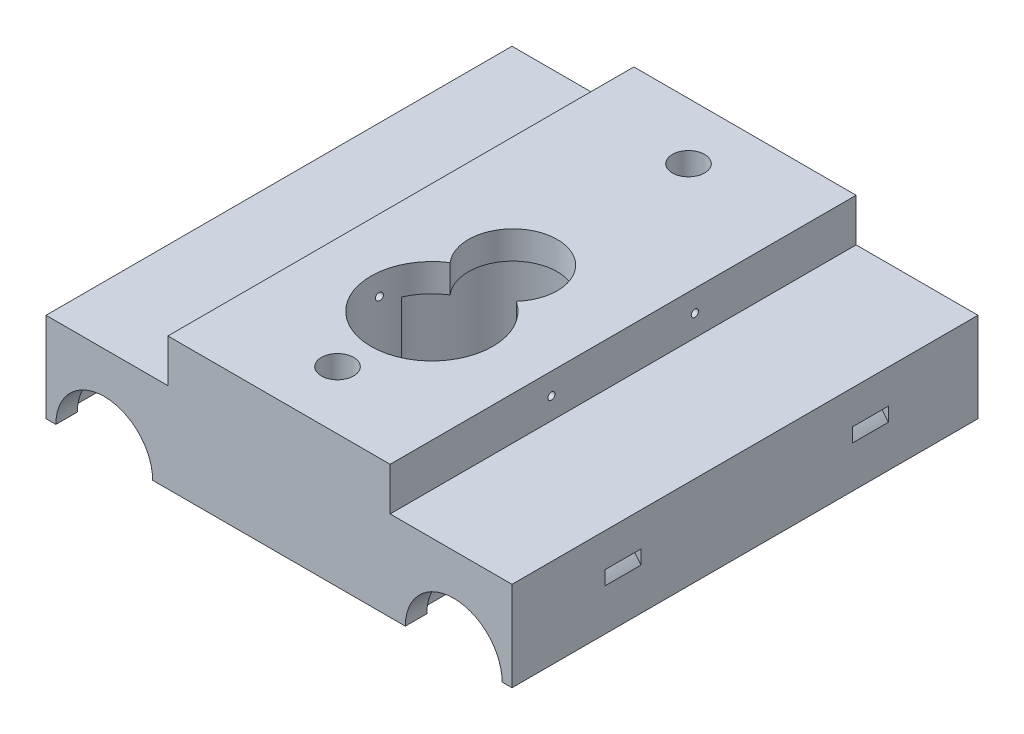
from build123d import *
from build123d.topology import SkipClean

# Parameters (mm, degrees)
SKETCH_1_W           = 65
SKETCH_1_H           = 65
EXTRUDE_1_DEPTH      = 17
CUT_EXTRUDE_1_DEPTH  = 59
CUT_EXTRUDE_2_DEPTH  = 79.260612028
EXTRUDE_2_DEPTH      = 10
SKETCH_12_W          = 35.24
SKETCH_12_H          = 8.5
CUT_EXTRUDE_5_DEPTH  = 79.260612028
SKETCH_17_R          = 2.25
CUT_EXTRUDE_8_DEPTH  = 58.965697588
EXTRUDE_START        = 10
SKETCH_18_W          = 65
SKETCH_18_H          = 65
SKETCH_18_R          = 2.25
EXTRUDE_3_DEPTH      = 10
CUT_EXTRUDE_START    = -10
SKETCH_9_R           = 11.25
SKETCH_9_R_2         = 10
CUT_EXTRUDE_3_DEPTH  = 5
CUT_EXTRUDE_START_2  = -20
SKETCH_10_R          = 11.25
SKETCH_10_R_2        = 10
CUT_EXTRUDE_4_DEPTH  = 5
SKETCH_19_W          = 65
SKETCH_19_H          = 6
CUT_EXTRUDE_9_DEPTH  = 17
SKETCH_20_W          = 65
SKETCH_20_H          = 6
CUT_EXTRUDE_10_DEPTH = 17
SKETCH_21_R          = 0.5
CUT_EXTRUDE_11_DEPTH = 69.629794564
CUT_EXTRUDE_12_DEPTH = 3.9
CUT_EXTRUDE_13_DEPTH = 60.168674963


with BuildPart() as part:
    # Эскиз1 → Бобышка-Вытянуть1 (new body)
    with BuildSketch(Plane(origin=(0, 0, 0), x_dir=(1, 0, 0), z_dir=(0, 1, 0))):
        with Locations((7.633818594, -8.451785088)):
            Rectangle(SKETCH_1_W, SKETCH_1_H)
    extrude(amount=EXTRUDE_1_DEPTH)

    # Эскиз3 → Вырез-Вытянуть1 (cut)
    with BuildSketch(Plane.XY.offset(37.951785088)):
        with BuildLine():
            Line((39.753818594, 8.5), (40.133818594, 8.5))
            Line((40.133818594, 8.5), (40.133818594, 0))
            Line((40.133818594, 0), (24.253818594, 0))
            Line((24.253818594, 0), (24.253818594, 8.5))
            ThreePointArc((24.253818594, 8.5), (32.003818594, 16.25), (39.753818594, 8.5))
        make_face()
        with BuildLine():
            Line((-24.486181406, 8.5), (-24.866181406, 8.5))
            Line((-24.866181406, 8.5), (-24.866181406, 0))
            Line((-24.866181406, 0), (-8.986181406, 0))
            Line((-8.986181406, 0), (-8.986181406, 8.5))
            ThreePointArc((-8.986181406, 8.5), (-16.736181406, 16.25), (-24.486181406, 8.5))
        make_face()
    extrude(amount=-CUT_EXTRUDE_1_DEPTH, mode=Mode.SUBTRACT)

    # Эскиз5 → Вырез-Вытянуть2 (cut, through all)
    with BuildSketch(Plane.XY.offset(40.951785088)):
        with BuildLine():
            Line((-23.486181406, 8.5), (-24.866181406, 8.5))
            Line((-24.866181406, 8.5), (-24.866181406, 0))
            Line((-24.866181406, 0), (-9.986181406, 0))
            Line((-9.986181406, 0), (-9.986181406, 8.5))
            ThreePointArc((-9.986181406, 8.5), (-16.736181406, 15.25), (-23.486181406, 8.5))
        make_face()
        with BuildLine():
            Line((38.753818594, 8.5), (40.133818594, 8.5))
            Line((40.133818594, 8.5), (40.133818594, 0))
            Line((40.133818594, 0), (25.253818594, 0))
            Line((25.253818594, 0), (25.253818594, 8.5))
            ThreePointArc((25.253818594, 8.5), (32.003818594, 15.25), (38.753818594, 8.5))
        make_face()
    extrude(amount=-CUT_EXTRUDE_2_DEPTH, mode=Mode.SUBTRACT)

    # Эскиз6 → Бобышка-Вытянуть2 (add)
    with BuildSketch(Plane.XY.offset(13.451785088)):
        with BuildLine():
            Line((-23.486181406, 8.5), (-24.866181406, 8.5))
            Line((-24.866181406, 8.5), (-24.866181406, 17))
            Line((-24.866181406, 17), (-9.986181406, 17))
            Line((-9.986181406, 17), (40.133818594, 17))
            Line((40.133818594, 17), (40.133818594, 8.5))
            Line((40.133818594, 8.5), (38.753818594, 8.5))
            ThreePointArc((38.753818594, 8.5), (32.003818594, 15.25), (25.253818594, 8.5))
            Line((25.253818594, 8.5), (25.253818594, 0))
            Line((25.253818594, 0), (-9.986181406, 0))
            Line((-9.986181406, 0), (-9.986181406, 8.5))
            ThreePointArc((-9.986181406, 8.5), (-16.736181406, 15.25), (-23.486181406, 8.5))
        make_face()
    extrude(amount=-EXTRUDE_2_DEPTH)

    # Эскиз12 → Вырез-Вытянуть5 (cut, through all)
    with BuildSketch(Plane.XY.offset(40.951785088)):
        with Locations((7.633818594, 4.25)):
            Rectangle(SKETCH_12_W, SKETCH_12_H)
    extrude(amount=-CUT_EXTRUDE_5_DEPTH, mode=Mode.SUBTRACT)

    # Эскиз17 → Вырез-Вытянуть8 (cut, through all)
    with BuildSketch(Plane(origin=(0, 17, 0), x_dir=(1, 0, 0), z_dir=(0, 1, 0))):
        with Locations((7.633818594, 16.168732948)):
            Circle(SKETCH_17_R)
        with Locations((7.676184998, -32.831267052)):
            Circle(SKETCH_17_R)
    extrude(amount=-CUT_EXTRUDE_8_DEPTH, mode=Mode.SUBTRACT)

    # Эскиз18 → Бобышка-Вытянуть3 (add)
    with BuildSketch(Plane(origin=(0, 17, 0), x_dir=(1, 0, 0), z_dir=(0, 1, 0)).offset(EXTRUDE_START)):
        with Locations((7.633818594, -8.451785088)):
            Rectangle(SKETCH_18_W, SKETCH_18_H)
        with Locations((7.633818594, 16.168732948)):
            Circle(SKETCH_18_R, mode=Mode.SUBTRACT)
        with Locations((7.676184998, -32.831267052)):
            Circle(SKETCH_18_R, mode=Mode.SUBTRACT)
    extrude(amount=-EXTRUDE_3_DEPTH)

    # Эскиз9 → Вырез-Вытянуть3 (cut)
    # profile 1 of 2: a face of its own
    with BuildSketch(Plane.XY.offset(37.951785088).offset(CUT_EXTRUDE_START)):
        with Locations((-16.736181406, 8.5)):
            Circle(SKETCH_9_R)
        with Locations((-16.736181406, 8.5)):
            Circle(SKETCH_9_R_2, mode=Mode.SUBTRACT)
    # profile 2 of 2: a face of its own
    with BuildSketch(Plane.XY.offset(37.951785088).offset(CUT_EXTRUDE_START)):
        with Locations((32.003818594, 8.5)):
            Circle(SKETCH_9_R)
        with Locations((32.003818594, 8.5)):
            Circle(SKETCH_9_R_2, mode=Mode.SUBTRACT)
    extrude(amount=-CUT_EXTRUDE_3_DEPTH, mode=Mode.SUBTRACT)

    # Эскиз10 → Вырез-Вытянуть4 (cut)
    # profile 1 of 2: a face of its own
    with BuildSketch(Plane.XY.offset(13.451785088).offset(CUT_EXTRUDE_START_2)):
        with Locations((-16.736181406, 8.5)):
            Circle(SKETCH_10_R)
        with Locations((-16.736181406, 8.5)):
            Circle(SKETCH_10_R_2, mode=Mode.SUBTRACT)
    # profile 2 of 2: a face of its own
    with BuildSketch(Plane.XY.offset(13.451785088).offset(CUT_EXTRUDE_START_2)):
        with Locations((32.003818594, 8.5)):
            Circle(SKETCH_10_R)
        with Locations((32.003818594, 8.5)):
            Circle(SKETCH_10_R_2, mode=Mode.SUBTRACT)
    extrude(amount=-CUT_EXTRUDE_4_DEPTH, mode=Mode.SUBTRACT)

    # Эскиз19 → Вырез-Вытянуть9 (cut)
    with BuildSketch(Plane(origin=(40.133818594, 0, 0), x_dir=(0, 0, -1), z_dir=(1, 0, 0))):
        with Locations((-8.451785088, 24)):
            Rectangle(SKETCH_19_W, SKETCH_19_H)
    extrude(amount=-CUT_EXTRUDE_9_DEPTH, mode=Mode.SUBTRACT)

    # Эскиз20 → Вырез-Вытянуть10 (cut)
    with BuildSketch(Plane.ZY.offset(24.866181406)):
        with Locations((8.451785088, 24)):
            Rectangle(SKETCH_20_W, SKETCH_20_H)
    extrude(amount=-CUT_EXTRUDE_10_DEPTH, mode=Mode.SUBTRACT)

    # Эскиз21 → Вырез-Вытянуть11 (cut, through all)
    with BuildSketch(Plane(origin=(23.133818594, 0, 0), x_dir=(0, 0, -1), z_dir=(1, 0, 0))):
        with Locations((-18.451785088, 24)):
            Circle(SKETCH_21_R)
        with Locations((1.548214912, 24)):
            Circle(SKETCH_21_R)
    extrude(amount=-CUT_EXTRUDE_11_DEPTH, mode=Mode.SUBTRACT)

    # Эскиз13 → Вырез-Вытянуть12 (cut)
    with BuildSketch(Plane.XZ.offset(-27)):
        with BuildLine():
            ThreePointArc((2.962122683, 12.40744876), (7.675512515, 2.131407246), (12.250269981, 12.469911346))
            ThreePointArc((12.250269981, 12.469911346), (7.501160594, 28.057428262), (2.962122683, 12.40744876))
        make_face()
    extrude(amount=CUT_EXTRUDE_12_DEPTH, mode=Mode.SUBTRACT)

    # Эскиз24 → Вырез-Вытянуть13 (cut, through all)
    with SkipClean():  # the faces are left unmerged after this step: merging them gives an invalid solid
        with BuildSketch(Plane(origin=(0, 23.1, 0), x_dir=(1, 0, 0), z_dir=(0, 1, 0))):
            with BuildLine():
                ThreePointArc((-0.190214084, -16.063311585), (7.501160594, -28.057428262), (15.353152659, -16.167840384))
                ThreePointArc((15.353152659, -16.167840384), (7.707791679, 2.668484217), (-0.190214084, -16.063311585))
            make_face()
        extrude(amount=-CUT_EXTRUDE_13_DEPTH, mode=Mode.SUBTRACT)


solid = part.part
